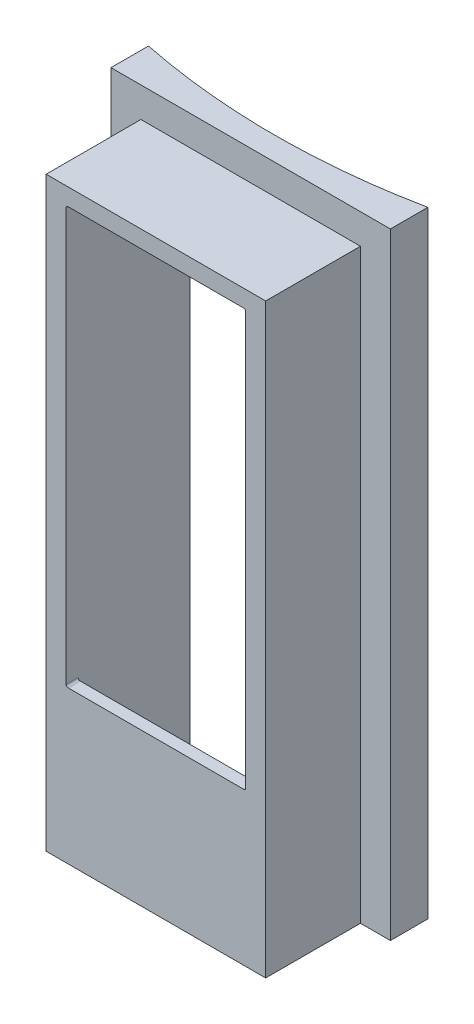
from build123d import *

# Parameters (mm, degrees)
SKETCH1_W           = 88.9
SKETCH1_H           = 196.088
EXTRUDE1_DEPTH      = 230.2002
SKETCH5_W           = 69.85
SKETCH5_H           = 186.563
EXTRUDE4_DEPTH      = 30.15234
EXTRUDE2_DEPTH      = 93.98
EXTRUDE2_DEPTH_BACK = 273.8502
SKETCH4_W           = 57.15
SKETCH4_H           = 132.588
SKETCH6_W           = 57.15
SKETCH6_H           = 45.974
SKETCH6_H_2         = 2.921
EXTRUDE5_DEPTH      = 256.54
FILLET1_R           = 2.54
SKETCH2_R           = 222.758
EXTRUDE3_DEPTH      = 202.86
FILLET2_R           = 0.635


with BuildPart() as part:
    # Sketch1 → Extrude1 (new body)
    with BuildSketch(Plane.XY):
        with Locations((0, -2.159)):
            Rectangle(SKETCH1_W, SKETCH1_H)
    extrude(amount=EXTRUDE1_DEPTH)

    # Sketch5 → Extrude4 (add)
    with BuildSketch(Plane.XY.offset(230.2002)):
        with Locations((0, -6.9215)):
            Rectangle(SKETCH5_W, SKETCH5_H)
    extrude(amount=EXTRUDE4_DEPTH)

    # Sketch4 → Extrude2 (cut, two sides: drawn at the far end of the back side and taken through both)
    with BuildSketch(Plane.XY.offset(230.2002).offset(-EXTRUDE2_DEPTH_BACK)):
        with Locations((0, 14.605)):
            Rectangle(SKETCH4_W, SKETCH4_H)
    extrude(amount=EXTRUDE2_DEPTH + EXTRUDE2_DEPTH_BACK, mode=Mode.SUBTRACT)

    # Sketch6 → Extrude5 (cut)
    with BuildSketch(Plane(origin=(0, 0, 0), x_dir=(-1, 0, 0), z_dir=(0, 0, -1))):
        with Locations((0, -74.676)):
            Rectangle(SKETCH6_W, SKETCH6_H)
        with Locations((0, 82.3595)):
            Rectangle(SKETCH6_W, SKETCH6_H_2)
    extrude(amount=-EXTRUDE5_DEPTH, mode=Mode.SUBTRACT)

    # Fillet1
    fillet1_edges = [part.edges().sort_by_distance(p)[0] for p in [
        (-28.575, -97.663, 128.27),
        (28.575, -97.663, 128.27),
        (-28.575, 83.82, 128.27),
        (28.575, 83.82, 128.27),
    ]]
    fillet(fillet1_edges, radius=FILLET1_R)

    # Sketch2 → Extrude3 (cut)
    with BuildSketch(Plane(origin=(0, 95.885, 0), x_dir=(-1, 0, 0), z_dir=(0, 1, 0))):
        Circle(SKETCH2_R)
    extrude(amount=-EXTRUDE3_DEPTH, mode=Mode.SUBTRACT)

    # Fillet2
    fillet2_edges = [part.edges().sort_by_distance(p)[0] for p in [
        (28.575, 80.899, 258.44627),
        (-28.575, 80.899, 258.44627),
        (-28.575, -51.689, 258.44627),
        (28.575, -51.689, 258.44627),
    ]]
    fillet(fillet2_edges, radius=FILLET2_R)


solid = part.part
